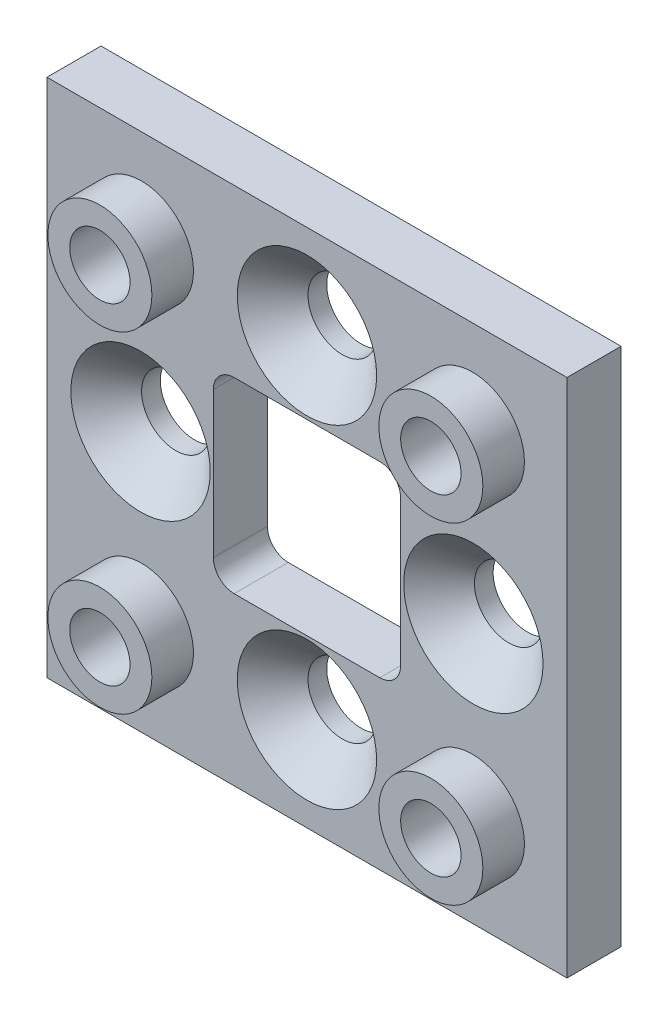
from build123d import *

# Parameters (mm, degrees)
SKETCH_1_W      = 25
SKETCH_1_H      = 25
SKETCH_1_R      = 1.65
SKETCH_1_R_2    = 1.45
SKETCH_1_W_2    = 9
SKETCH_1_H_2    = 9
EXTRUDE_1_DEPTH = 2.6
CHAMFER_1_SIZE  = 1.7
FILLET_1_R      = 1
SKETCH_2_R      = 2.5
SKETCH_2_R_2    = 1.45
EXTRUDE_2_DEPTH = 2


with BuildPart() as part:
    # 草图1 → 凸台-拉伸1 (new body)
    with BuildSketch(Plane.XY):
        Rectangle(SKETCH_1_W, SKETCH_1_H)
        with Locations((0, 8)):
            Circle(SKETCH_1_R, mode=Mode.SUBTRACT)
        with Locations((8, 0)):
            Circle(SKETCH_1_R, mode=Mode.SUBTRACT)
        with Locations((0, -8)):
            Circle(SKETCH_1_R, mode=Mode.SUBTRACT)
        with Locations((-8, 0)):
            Circle(SKETCH_1_R, mode=Mode.SUBTRACT)
        with Locations((7.954951288, 7.954951288)):
            Circle(SKETCH_1_R_2, mode=Mode.SUBTRACT)
        with Locations((7.954951288, -7.954951288)):
            Circle(SKETCH_1_R_2, mode=Mode.SUBTRACT)
        with Locations((-7.954951288, -7.954951288)):
            Circle(SKETCH_1_R_2, mode=Mode.SUBTRACT)
        with Locations((-7.954951288, 7.954951288)):
            Circle(SKETCH_1_R_2, mode=Mode.SUBTRACT)
        Rectangle(SKETCH_1_W_2, SKETCH_1_H_2, mode=Mode.SUBTRACT)
    extrude(amount=EXTRUDE_1_DEPTH)

    # 倒角1
    chamfer_1_edges = [part.edges().sort_by_distance(p)[0] for p in [
        (-1.65, 8, 2.6),
        (-1.65, -8, 2.6),
        (6.35, 0, 2.6),
        (-9.65, 0, 2.6),
    ]]
    chamfer(chamfer_1_edges, length=CHAMFER_1_SIZE)

    # 圆角1
    fillet_1_edges = [part.edges().sort_by_distance(p)[0] for p in [
        (-4.5, -4.5, 1.3),
        (4.5, 4.5, 1.3),
        (4.5, -4.5, 1.3),
        (-4.5, 4.5, 1.3),
    ]]
    fillet(fillet_1_edges, radius=FILLET_1_R)

    # 草图2 → 凸台-拉伸2 (add)
    # profile 1 of 4: a face of its own
    with BuildSketch(Plane.XY.offset(2.6)):
        with Locations((-7.954951288, 7.954951288)):
            Circle(SKETCH_2_R)
        with Locations((-7.954951288, 7.954951288)):
            Circle(SKETCH_2_R_2, mode=Mode.SUBTRACT)
    # profile 2 of 4: a face of its own
    with BuildSketch(Plane.XY.offset(2.6)):
        with Locations((7.954951288, 7.954951288)):
            Circle(SKETCH_2_R)
        with Locations((7.954951288, 7.954951288)):
            Circle(SKETCH_2_R_2, mode=Mode.SUBTRACT)
    # profile 3 of 4: a face of its own
    with BuildSketch(Plane.XY.offset(2.6)):
        with Locations((7.954951288, -7.954951288)):
            Circle(SKETCH_2_R)
        with Locations((7.954951288, -7.954951288)):
            Circle(SKETCH_2_R_2, mode=Mode.SUBTRACT)
    # profile 4 of 4: a face of its own
    with BuildSketch(Plane.XY.offset(2.6)):
        with Locations((-7.954951288, -7.954951288)):
            Circle(SKETCH_2_R)
        with Locations((-7.954951288, -7.954951288)):
            Circle(SKETCH_2_R_2, mode=Mode.SUBTRACT)
    extrude(amount=EXTRUDE_2_DEPTH)


solid = part.part
